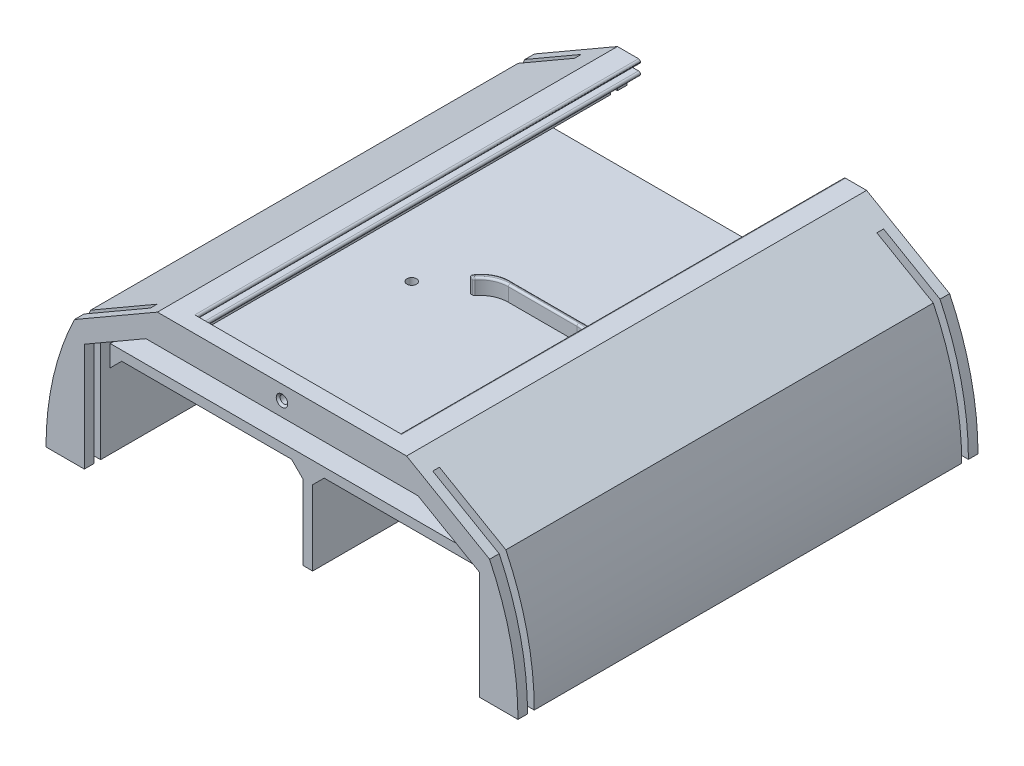
from build123d import *

# Parameters (mm, degrees)
BOSS_EXTRUDE1_DEPTH             = 240
CUT_EXTRUDE4_DEPTH              = 285.354710913
CUT_EXTRUDE4_DEPTH_BACK         = 285.354710913
CUT_EXTRUDE5_DEPTH              = 285.354710913
CUT_EXTRUDE5_DEPTH_BACK         = 285.354710913
SKETCH3_W                       = 3.5
SKETCH3_H                       = 170
SKETCH3_H_2                     = 167
BOSS_EXTRUDE4_REACH             = 286.355
SKETCH7_W                       = 213
SKETCH7_H                       = 5
BOSS_EXTRUDE4_DIRECTION_2_REACH = 286.355
CHAMFER7_SIZE                   = 6
SKETCH8_W                       = 5
SKETCH8_H                       = 213
BOSS_EXTRUDE5_DEPTH             = 120
CHAMFER8_SIZE                   = 6
CUT_EXTRUDE6_DEPTH              = 23
CUT_EXTRUDE6_DEPTH_BACK         = 176
SKETCH10_W                      = 25
SKETCH10_H                      = 6
BOSS_EXTRUDE6_DEPTH             = 90
FILLET1_R                       = 10
FILLET2_R                       = 10
SKETCH13_R                      = 2.5
CUT_EXTRUDE7_DEPTH              = 285.354710913
SKETCH14_R                      = 2.5
CUT_EXTRUDE8_DEPTH              = 47
SKETCH15_R                      = 2.5
CUT_EXTRUDE9_DEPTH              = 36
SKETCH16_W                      = 6
SKETCH16_H                      = 100
SKETCH16_W_2                    = 20
SKETCH16_H_2                    = 85
CUT_EXTRUDE10_DEPTH             = 8
SKETCH20_W                      = 2
SKETCH20_H                      = 100
SKETCH20_W_2                    = 1.5
SKETCH20_H_2                    = 85
BOSS_EXTRUDE7_DEPTH             = 8
CUT_EXTRUDE11_REACH             = 230.38
FILLET4_R                       = 0.25
FILLET5_R                       = 1
SKETCH22_W                      = 20
SKETCH22_H                      = 10
CUT_EXTRUDE12_DEPTH             = 43
CHAMFER9_SIZE                   = 1
BOSS_EXTRUDE8_DEPTH             = 8
FILLET6_R                       = 1
FILLET7_R                       = 1
SKETCH25_R                      = 35
CUT_EXTRUDE13_DEPTH             = 5
CUT_EXTRUDE14_START             = -105
SKETCH26_W                      = 25
SKETCH26_H                      = 70
CUT_EXTRUDE14_DEPTH             = 12.5
SKETCH27_W                      = 10
SKETCH27_H                      = 70
BOSS_EXTRUDE9_DEPTH             = 9
FILLET8_R                       = 1
CUT_EXTRUDE15_START             = -30
CUT_EXTRUDE15_DEPTH             = 10
FILLET9_R                       = 1
FILLET10_R                      = 2
CHAMFER10_SIZE                  = 1
CUT_EXTRUDE16_DEPTH             = 285.354710957
CUT_EXTRUDE16_DEPTH_BACK        = 285.354710957
SKETCH29_W                      = 279.826447053
SKETCH29_H                      = 99.521985241
SKETCH30_W                      = 10
SKETCH30_H                      = 143
CUT_EXTRUDE17_DEPTH             = 20
CHAMFER11_SIZE                  = 3
CUT_EXTRUDE19_START             = -8.5
CUT_EXTRUDE19_DEPTH             = 276.854710957
FILLET11_R                      = 1
SKETCH33_R                      = 2
CUT_EXTRUDE20_DEPTH             = 4.5
CHAMFER12_SIZE                  = 1


# Some blends are built 0.0001 mm under size
with BuildPart() as part:
    # Sketch1 → Boss-Extrude1 (new body)
    with BuildSketch(Plane.XY):
        with BuildLine():
            Line((-65, 90), (-108.301270189, 65))
            ThreePointArc((-108.301270189, 65), (-123.116211843, 0), (-108.301270189, -65))
            Line((-108.301270189, -65), (-65, -90))
            Line((-65, -90), (65, -90))
            Line((65, -90), (108.301270189, -65))
            ThreePointArc((108.301270189, -65), (123.116211843, 0), (108.301270189, 65))
            Line((108.301270189, 65), (65, 90))
            Line((65, 90), (-65, 90))
        make_face()
    extrude(amount=BOSS_EXTRUDE1_DEPTH)

    # Sketch2 → Cut-Extrude4 (cut, two sides: drawn at the far end of the back side and taken through both)
    with BuildSketch(Plane.XY.offset(240).offset(-CUT_EXTRUDE4_DEPTH_BACK)):
        Polygon((-70.980762114, 75), (70.980762114, 75), (103.116211843, 56.446589448), (103.116211843, -56.446589448), (70.980762114, -75), (-70.980762114, -75), (-103.116211843, -56.446589448), (-103.116211843, 56.446589448), align=None)
    extrude(amount=CUT_EXTRUDE4_DEPTH + CUT_EXTRUDE4_DEPTH_BACK, mode=Mode.SUBTRACT)

    # Sketch3 → Cut-Extrude5 (cut, two sides: drawn at the far end of the back side and taken through both)
    with BuildSketch(Plane(origin=(0, 0, 0), x_dir=(0, 0, -1), z_dir=(1, 0, 0)).offset(-CUT_EXTRUDE5_DEPTH_BACK)):
        with Locations((-233.25, 0)):
            Rectangle(SKETCH3_W, SKETCH3_H)
        with Locations((-6.75, -1.5)):
            Rectangle(SKETCH3_W, SKETCH3_H_2)
    extrude(amount=CUT_EXTRUDE5_DEPTH + CUT_EXTRUDE5_DEPTH_BACK, mode=Mode.SUBTRACT)

    # Boss-Extrude4: up to this face of the body (flat: up to its plane)
    boss_extrude4_end = Plane(part.part.faces().sort_by_distance((103.116211843, 0, 120))[0])
    # Sketch7 → Boss-Extrude4 (add, up to the picked face)
    with BuildSketch(Plane(origin=(0, 0, 0), x_dir=(0, 0, -1), z_dir=(1, 0, 0)), mode=Mode.PRIVATE) as boss_extrude4_sk1:
        with Locations((-120, 47.5)):
            Rectangle(SKETCH7_W, SKETCH7_H)
    boss_extrude4_tool1 = split(extrude(boss_extrude4_sk1.sketch, amount=BOSS_EXTRUDE4_REACH, mode=Mode.PRIVATE), bisect_by=boss_extrude4_end, keep=Keep.BOTH, mode=Mode.PRIVATE)
    add(boss_extrude4_tool1.solids().sort_by(Axis((0, 47.5, 120), (1, 0, 0)))[0])

    # Boss-Extrude4 direction 2: up to this face of the body (flat: up to its plane)
    boss_extrude4_direction_2_end = Plane(part.part.faces().sort_by_distance((-103.116211843, 0, 120))[0])
    # Sketch7 → Boss-Extrude4 direction 2 (add, up to the picked face)
    with BuildSketch(Plane(origin=(0, 0, 0), x_dir=(0, 0, -1), z_dir=(1, 0, 0)), mode=Mode.PRIVATE) as boss_extrude4_direction_2_sk1:
        with Locations((-120, 47.5)):
            Rectangle(SKETCH7_W, SKETCH7_H)
    boss_extrude4_direction_2_tool1 = split(extrude(boss_extrude4_direction_2_sk1.sketch, amount=-BOSS_EXTRUDE4_DIRECTION_2_REACH, mode=Mode.PRIVATE), bisect_by=boss_extrude4_direction_2_end, keep=Keep.BOTH, mode=Mode.PRIVATE)
    add(boss_extrude4_direction_2_tool1.solids().sort_by(Axis((0, 47.5, 120), (-1, 0, 0)))[0])

    # Chamfer7
    chamfer7_edges = [part.edges().sort_by_distance(p)[0] for p in [
        (-103.116211843, 45, 120),
        (103.116211843, 45, 120),
    ]]
    chamfer(chamfer7_edges, length=CHAMFER7_SIZE)

    # Sketch8 → Boss-Extrude5 (add)
    with BuildSketch(Plane(origin=(0, -75, 0), x_dir=(1, 0, 0), z_dir=(0, 1, 0))):
        with Locations((0, -120)):
            Rectangle(SKETCH8_W, SKETCH8_H)
    extrude(amount=BOSS_EXTRUDE5_DEPTH)

    # Chamfer8
    chamfer8_edges = [part.edges().sort_by_distance(p)[0] for p in [
        (2.5, -75, 120),
        (-2.5, -75, 120),
        (2.5, 45, 120),
        (-2.5, 45, 120),
    ]]
    chamfer(chamfer8_edges, length=CHAMFER8_SIZE)

    # Sketch10 → Cut-Extrude6 (cut, two sides: drawn at the far end of the back side and taken through both)
    with BuildSketch(Plane(origin=(0, 0, 0), x_dir=(0, 0, -1), z_dir=(1, 0, 0)).offset(-CUT_EXTRUDE6_DEPTH_BACK)):
        with Locations((-120, -72)):
            Rectangle(SKETCH10_W, SKETCH10_H)
    extrude(amount=CUT_EXTRUDE6_DEPTH + CUT_EXTRUDE6_DEPTH_BACK, mode=Mode.SUBTRACT)

    # Sketch12 → Boss-Extrude6 (add)
    with BuildSketch(Plane(origin=(0, 0, 0), x_dir=(0, 0, -1), z_dir=(1, 0, 0))):
        Polygon((-10, -64), (-230, -64), (-230, -75), (-132.5, -75), (-132.5, -69), (-107.5, -69), (-107.5, -75), (-10, -75), align=None)
    extrude(amount=-BOSS_EXTRUDE6_DEPTH)

    # Fillet1
    # the kernel refuses this fillet: 10 mm, written as the material it takes off along each edge
    with BuildSketch(Plane(origin=(0, -75, 10), x_dir=(-1, 0, 0), z_dir=(0, 1, 0))) as fillet1_piece_1:
        with BuildLine():
            CenterArc((7.599342077, 10), FILLET1_R, 220.541601874, 49.458398126)
            Line((0, 3.5), (-0.151986842, 3.37))
            ThreePointArc((-0.151986842, 3.37), (-0.2, 1.75), (-0.2, 0))
            Line((-0.2, 0), (0, -0.2))
            Line((0, -0.2), (7.599342077, -0.2))
            Line((7.599342077, -0.2), (7.599342077, 0))
        make_face()
    extrude(amount=29.998355192, mode=Mode.SUBTRACT)

    # Fillet2
    # the kernel refuses this fillet: 10 mm, written as the material it takes off along each edge
    with BuildSketch(Plane(origin=(0, -45.001644808, 230), x_dir=(0, 0, -1), z_dir=(0, -1, 0))) as fillet2_piece_1:
        with BuildLine():
            CenterArc((10, -7.599342077), FILLET2_R, 130.541601874, 49.458398126)
            Line((0, -7.599342077), (-0.2, -7.599342077))
            Line((-0.2, -7.599342077), (-0.2, 0))
            Line((-0.2, 0), (0, 0.2))
            ThreePointArc((0, 0.2), (1.75, 0.2), (3.37, 0.151986842))
            Line((3.37, 0.151986842), (3.5, 0))
        make_face()
    extrude(amount=29.998355192, mode=Mode.SUBTRACT)

    # Sketch13 → Cut-Extrude7 (cut, through all)
    with BuildSketch(Plane(origin=(0, 0, 0), x_dir=(0, 0, -1), z_dir=(1, 0, 0))):
        with Locations((-173.35, 62)):
            Circle(SKETCH13_R)
        with Locations((-66.65, 62)):
            Circle(SKETCH13_R)
        with Locations((-120, 62)):
            Circle(SKETCH13_R)
    extrude(amount=-CUT_EXTRUDE7_DEPTH, mode=Mode.SUBTRACT)

    # Sketch14 → Cut-Extrude8 (cut)
    with BuildSketch(Plane(origin=(0, 50, 0), x_dir=(1, 0, 0), z_dir=(0, 1, 0))):
        with Locations(Location((-52.5, -119.8, 0), (0, 0, 270))):
            Circle(SKETCH14_R)
    extrude(amount=-CUT_EXTRUDE8_DEPTH, mode=Mode.SUBTRACT)

    # Sketch15 → Cut-Extrude9 (cut)
    with BuildSketch(Plane(origin=(-103.116211843, 0, 0), x_dir=(0, 0, -1), z_dir=(1, 0, 0))):
        with Locations(Location((-172.99, 24, 0), (0, 0, 90))):
            Circle(SKETCH15_R)
        with Locations(Location((-67.25, 24, 0), (0, 0, 90))):
            Circle(SKETCH15_R)
    extrude(amount=-CUT_EXTRUDE9_DEPTH, mode=Mode.SUBTRACT)

    # Sketch16 → Cut-Extrude10 (cut)
    with BuildSketch(Plane(origin=(0, -75, 0), x_dir=(1, 0, 0), z_dir=(0, 1, 0))):
        with Locations((26.5, -120)):
            Rectangle(SKETCH16_W, SKETCH16_H)
        with Locations((49.5, -120)):
            Rectangle(SKETCH16_W_2, SKETCH16_H_2)
    extrude(amount=-CUT_EXTRUDE10_DEPTH, mode=Mode.SUBTRACT)

    # Sketch20 → Boss-Extrude7 (add)
    with BuildSketch(Plane(origin=(0, -75, 0), x_dir=(1, 0, 0), z_dir=(0, 1, 0))):
        with Locations((22, -120)):
            Rectangle(SKETCH20_W, SKETCH20_H)
        with Locations((31, -120)):
            Rectangle(SKETCH20_W, SKETCH20_H)
        with Locations((38.25, -120)):
            Rectangle(SKETCH20_W_2, SKETCH20_H_2)
        with Locations((60.75, -120)):
            Rectangle(SKETCH20_W_2, SKETCH20_H_2)
    extrude(amount=BOSS_EXTRUDE7_DEPTH)

    # Sketch21 → Cut-Extrude11 (cut, up to next)
    with BuildSketch(Plane.XY.offset(170), mode=Mode.PRIVATE) as cut_extrude11_sk1:
        Polygon((22.5, -67), (21, -73.754220204), (21, -67), align=None)
    cut_extrude11_tool1 = extrude(cut_extrude11_sk1.sketch, amount=-CUT_EXTRUDE11_REACH, mode=Mode.PRIVATE) & part.part
    # Sketch21 → Cut-Extrude11 (cut, up to next)
    with BuildSketch(Plane.XY.offset(170), mode=Mode.PRIVATE) as cut_extrude11_sk2:
        Polygon((30.5, -67), (32, -67), (32, -73.754220204), align=None)
    cut_extrude11_tool2 = extrude(cut_extrude11_sk2.sketch, amount=-CUT_EXTRUDE11_REACH, mode=Mode.PRIVATE) & part.part
    # Sketch21 → Cut-Extrude11 (cut, up to next)
    with BuildSketch(Plane.XY.offset(170), mode=Mode.PRIVATE) as cut_extrude11_sk3:
        Polygon((38.5, -67), (37.5, -73.754220204), (37.5, -67), align=None)
    cut_extrude11_tool3 = extrude(cut_extrude11_sk3.sketch, amount=-CUT_EXTRUDE11_REACH, mode=Mode.PRIVATE) & part.part
    # Sketch21 → Cut-Extrude11 (cut, up to next)
    with BuildSketch(Plane.XY.offset(170), mode=Mode.PRIVATE) as cut_extrude11_sk4:
        Polygon((60.5, -67), (61.5, -73.754220204), (61.5, -67), align=None)
    cut_extrude11_tool4 = extrude(cut_extrude11_sk4.sketch, amount=-CUT_EXTRUDE11_REACH, mode=Mode.PRIVATE) & part.part
    add(cut_extrude11_tool1.solids().sort_by_distance((21.5, -69.251407, 170))[0], mode=Mode.SUBTRACT)
    add(cut_extrude11_tool2.solids().sort_by_distance((31.5, -69.251407, 170))[0], mode=Mode.SUBTRACT)
    add(cut_extrude11_tool3.solids().sort_by_distance((37.833333, -69.251407, 170))[0], mode=Mode.SUBTRACT)
    add(cut_extrude11_tool4.solids().sort_by_distance((61.166667, -69.251407, 170))[0], mode=Mode.SUBTRACT)

    # Fillet4
    fillet4_edges = [part.edges().sort_by_distance(p)[0] for p in [
        (23, -67, 120),
        (22.75, -67, 70),
        (30, -67, 120),
        (30.25, -67, 170),
        (39, -67, 120),
        (38.75, -67, 77.5),
        (60, -67, 120),
        (60.25, -67, 162.5),
        (60.25, -67, 77.5),
        (38.75, -67, 162.5),
        (30.25, -67, 70),
        (22.75, -67, 170),
        (22.5, -67, 120),
        (30.5, -67, 120),
        (38.5, -67, 120),
        (60.5, -67, 120),
    ]]
    fillet(fillet4_edges, radius=FILLET4_R)

    # Fillet5
    fillet5_edges = [part.edges().sort_by_distance(p)[0] for p in [
        (26.5, -75, 170),
        (26.5, -75, 70),
        (49.5, -75, 162.5),
        (49.5, -75, 77.5),
    ]]
    fillet(fillet5_edges, radius=FILLET5_R)

    # Sketch22 → Cut-Extrude12 (cut)
    with BuildSketch(Plane(origin=(61.5, 0, 0), x_dir=(0, 0, -1), z_dir=(1, 0, 0))):
        with Locations((-120, -70)):
            Rectangle(SKETCH22_W, SKETCH22_H)
    extrude(amount=-CUT_EXTRUDE12_DEPTH, mode=Mode.SUBTRACT)

    # Chamfer9
    chamfer9_edges = [part.edges().sort_by_distance(p)[0] for p in [
        (22, -75, 70),
        (22, -75, 170),
        (31, -75, 170),
        (31, -75, 70),
        (38.25, -75, 162.5),
        (38.25, -75, 77.5),
        (60.75, -75, 77.5),
        (60.75, -75, 162.5),
        (22, -75, 110),
        (31, -75, 110),
        (38.25, -75, 110),
        (60.75, -75, 110),
        (22, -75, 130),
        (31, -75, 130),
        (60.75, -75, 130),
        (38.25, -75, 130),
    ]]
    chamfer(chamfer9_edges, length=CHAMFER9_SIZE)

    # Sketch24 → Boss-Extrude8 (add)
    with BuildSketch(Plane(origin=(0, 50, 0), x_dir=(1, 0, 0), z_dir=(0, 1, 0))):
        with BuildLine():
            Line((-17.917763416, -104), (17.917763416, -104))
            ThreePointArc((17.917763416, -104), (24.66448127, -105.602918295), (29.969274127, -110.069093574))
            Line((29.969274127, -110.069093574), (32.969274127, -110.069093574))
            ThreePointArc((32.969274127, -110.069093574), (26.789760004, -103.436552281), (17.917763416, -101.575188443))
            Line((17.917763416, -101.575188443), (-17.917763416, -101.575188443))
            ThreePointArc((-17.917763416, -101.575188443), (-26.789760004, -103.436552281), (-32.969274127, -110.069093574))
            Line((-32.969274127, -110.069093574), (-29.969274127, -110.069093574))
            ThreePointArc((-29.969274127, -110.069093574), (-24.66448127, -105.602918295), (-17.917763416, -104))
        make_face()
    extrude(amount=BOSS_EXTRUDE8_DEPTH)

    # Fillet6
    fillet6_edges = [part.edges().sort_by_distance(p)[0] for p in [
        (29.969274127, 54, 110.069093574),
        (32.969274127, 54, 110.069093574),
        (-32.969274127, 54, 110.069093574),
        (-29.969274127, 54, 110.069093574),
    ]]
    fillet(fillet6_edges, radius=FILLET6_R)

    # Fillet7
    fillet7_edges = [part.edges().sort_by_distance(p)[0] for p in [
        (24.450244889, 58, 105.497160084),
        (0, 58, 101.575188443),
        (-26.017171128, 58, 103.029743215),
        (0, 58, 104),
        (26.017171128, 58, 103.029743215),
        (30.8728366, 58, 110.069093574),
        (-30.8728366, 58, 110.069093574),
        (-24.450244889, 58, 105.497160084),
        (-30.027267543, 58, 109.969282901),
        (-32.157772318, 58, 109.553459639),
        (30.027267543, 58, 109.969282901),
        (32.157772318, 58, 109.553459639),
    ]]
    fillet(fillet7_edges, radius=FILLET7_R)

    # Sketch25 → Cut-Extrude13 (cut)
    with BuildSketch(Plane(origin=(0, -64, 0), x_dir=(1, 0, 0), z_dir=(0, 1, 0))):
        with Locations(Location((-48.799671038, -46.5, 0), (0, 0, 270))):
            Circle(SKETCH25_R)
        with Locations(Location((-48.799671038, -120, 0), (0, 0, 270))):
            Circle(SKETCH25_R)
        with Locations(Location((-48.799671038, -193.5, 0), (0, 0, 270))):
            Circle(SKETCH25_R)
    extrude(amount=-CUT_EXTRUDE13_DEPTH, mode=Mode.SUBTRACT)

    # Sketch26 → Cut-Extrude14 (cut)
    with BuildSketch(Plane(origin=(0, 50, 0), x_dir=(1, 0, 0), z_dir=(0, 1, 0)).offset(CUT_EXTRUDE14_START)):
        with Locations((86.480762114, -120)):
            Rectangle(SKETCH26_W, SKETCH26_H)
    extrude(amount=-CUT_EXTRUDE14_DEPTH, mode=Mode.SUBTRACT)

    # Sketch27 → Boss-Extrude9 (add)
    with BuildSketch(Plane(origin=(0, -67.5, 0), x_dir=(1, 0, 0), z_dir=(0, 1, 0))):
        with Locations((78.97114317, -120)):
            Rectangle(SKETCH27_W, SKETCH27_H)
    extrude(amount=-BOSS_EXTRUDE9_DEPTH)

    # Fillet8
    fillet8_edges = [part.edges().sort_by_distance(p)[0] for p in [
        (73.97114317, -70.386751346, 155),
        (73.97114317, -70.386751346, 85),
        (78.97114317, -67.5, 85),
        (73.97114317, -67.5, 120),
        (78.97114317, -67.5, 155),
    ]]
    fillet(fillet8_edges, radius=FILLET8_R)

    # Sketch28 → Cut-Extrude15 (cut)
    with BuildSketch(Plane.XY.offset(155).offset(CUT_EXTRUDE15_START)):
        Polygon((73.97114317, -73.273502692), (83.97114317, -67.5), (73.97114317, -67.5), align=None)
    extrude(amount=-CUT_EXTRUDE15_DEPTH, mode=Mode.SUBTRACT)

    # Fillet9
    fillet9_edges = [part.edges().sort_by_distance(p)[0] for p in [
        (74.264036389, -67.792893219, 125),
        (74.264036389, -67.792893219, 115),
        (79.47114317, -67.5, 115),
        (73.97114317, -70.886751346, 115),
        (79.47114317, -67.5, 125),
        (73.97114317, -70.886751346, 125),
    ]]
    fillet(fillet9_edges, radius=FILLET9_R)

    # Fillet10
    fillet10_edges = [part.edges().sort_by_distance(p)[0] for p in [
        (91.475952642, -63.167096231, 85),
        (91.475952642, -63.167096231, 155),
        (98.980762114, -58.834192463, 120),
    ]]
    fillet(fillet10_edges, radius=FILLET10_R)

    # Chamfer10
    chamfer10_edges = [part.edges().sort_by_distance(p)[0] for p in [
        (-48.799671038, -64, 11.5),
        (-48.799671038, -64, 85),
        (-48.799671038, -64, 158.5),
    ]]
    chamfer(chamfer10_edges, length=CHAMFER10_SIZE)

    # Sketch29 → Cut-Extrude16 (cut, two sides: drawn at the far end of the back side and taken through both)
    with BuildSketch(Plane.XY.offset(-CUT_EXTRUDE16_DEPTH_BACK)):
        with Locations((4.431640565, -49.760992621)):
            Rectangle(SKETCH29_W, SKETCH29_H)
    extrude(amount=CUT_EXTRUDE16_DEPTH + CUT_EXTRUDE16_DEPTH_BACK, mode=Mode.SUBTRACT)

    # Sketch30 → Cut-Extrude17 (cut)
    with BuildSketch(Plane.XZ):
        with Locations((-113.116211843, 120)):
            Rectangle(SKETCH30_W, SKETCH30_H)
        with Locations((113.116211843, 120)):
            Rectangle(SKETCH30_W, SKETCH30_H)
    extrude(amount=-CUT_EXTRUDE17_DEPTH, mode=Mode.SUBTRACT)

    # Chamfer11
    chamfer11_edges = [part.edges().sort_by_distance(p)[0] for p in [
        (-118.116211843, 0, 120),
        (-113.116211843, 0, 48.5),
        (-108.116211843, 0, 120),
        (-113.116211843, 0, 191.5),
        (108.116211843, 0, 120),
        (113.116211843, 0, 48.5),
        (118.116211843, 0, 120),
        (113.116211843, 0, 191.5),
    ]]
    chamfer(chamfer11_edges, length=CHAMFER11_SIZE)

    # Sketch32 → Cut-Extrude19 (cut, through all)
    with BuildSketch(Plane.XY.offset(240).offset(CUT_EXTRUDE19_START)):
        Polygon((-53, 90), (-53, 88), (-60, 88), (-60, 84.5), (-53, 84.5), (-53, 82.5), (-60, 82.5), (-60, 75), (60, 75), (60, 82.5), (53, 82.5), (53, 84.5), (60, 84.5), (60, 88), (53, 88), (53, 90), align=None)
    extrude(amount=-CUT_EXTRUDE19_DEPTH, mode=Mode.SUBTRACT)

    # Fillet11
    fillet11_edges = [part.edges().sort_by_distance(p)[0] for p in [
        (-53, 90, 115.75),
        (-53, 88, 115.75),
        (-53, 84.5, 115.75),
        (-53, 82.5, 115.75),
        (53, 90, 115.75),
        (53, 88, 115.75),
        (53, 84.5, 115.75),
        (53, 82.5, 115.75),
    ]]
    fillet(fillet11_edges, radius=FILLET11_R - 0.0001)  # a hair under: the kernel refuses the full size

    # Sketch33 → Cut-Extrude20 (cut)
    with BuildSketch(Plane.XY.offset(240)):
        with Locations((0, 82.5)):
            Circle(SKETCH33_R)
    extrude(amount=-CUT_EXTRUDE20_DEPTH, mode=Mode.SUBTRACT)

    # Chamfer12
    chamfer12_edges = [part.edges().sort_by_distance(p)[0] for p in [
        (-2, 82.5, 240),
    ]]
    chamfer(chamfer12_edges, length=CHAMFER12_SIZE)


solid = part.part
